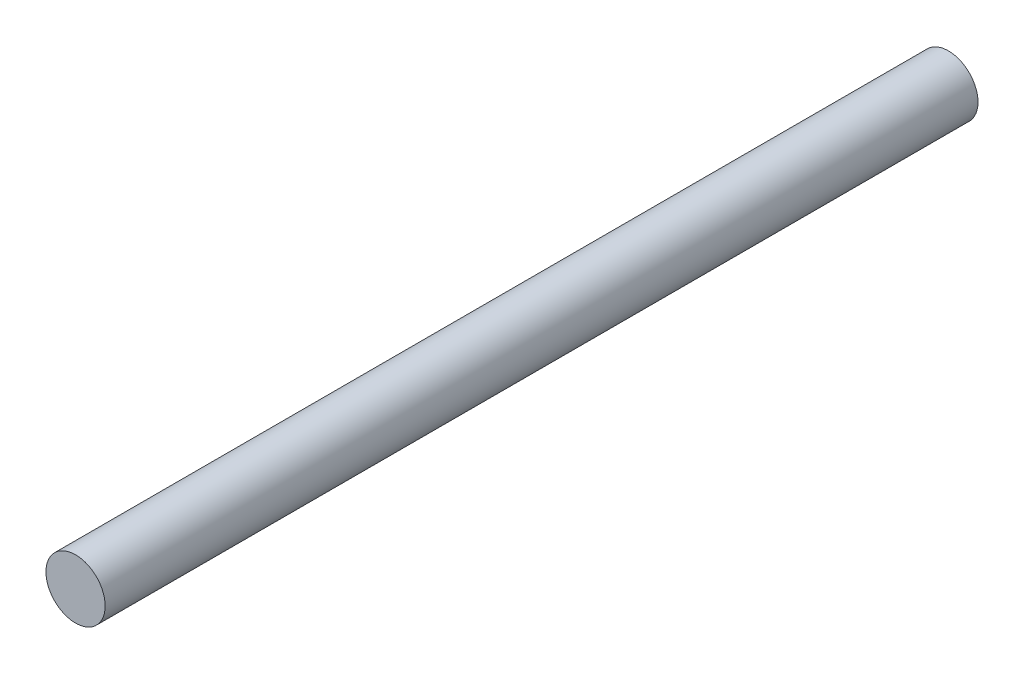
from build123d import *

# Parameters (mm, degrees)
SKETCH1_R           = 9
BOSS_EXTRUDE1_DEPTH = 265.32


with BuildPart() as part:
    # Sketch1 → Boss-Extrude1 (new body)
    with BuildSketch(Plane.XY):
        Circle(SKETCH1_R)
    extrude(amount=BOSS_EXTRUDE1_DEPTH)


solid = part.part
